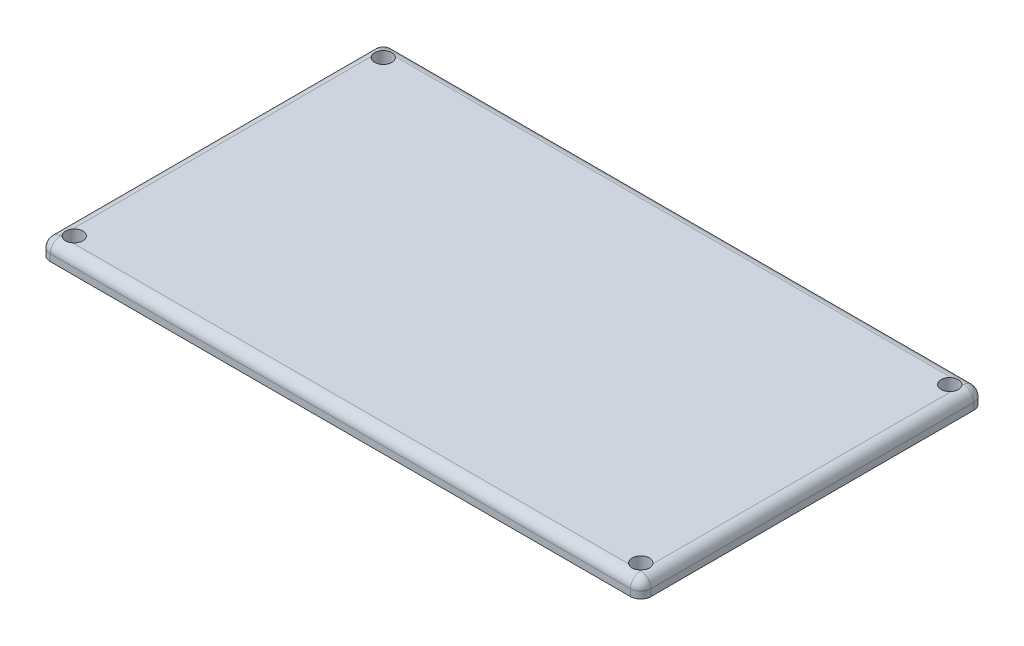
from build123d import *

# Parameters (mm, degrees)
SKETCH1_W           = 175
SKETCH1_H           = 100
BOSS_EXTRUDE1_DEPTH = 5
SKETCH2_R           = 2.5
CUT_EXTRUDE1_DEPTH  = 101.902180353
FILLET1_R           = 3


with BuildPart() as part:
    # Sketch1 → Boss-Extrude1 (new body)
    with BuildSketch(Plane(origin=(0, 0, 0), x_dir=(1, 0, 0), z_dir=(0, 1, 0))):
        Rectangle(SKETCH1_W, SKETCH1_H)
    extrude(amount=BOSS_EXTRUDE1_DEPTH)

    # Sketch2 → Cut-Extrude1 (cut, through all)
    with BuildSketch(Plane(origin=(0, 5, 0), x_dir=(1, 0, 0), z_dir=(0, 1, 0))):
        with Locations(Location((-82.5, 45, 0), (0, 0, 270))):
            Circle(SKETCH2_R)
        with Locations(Location((82.5, 45, 0), (0, 0, 90))):
            Circle(SKETCH2_R)
        with Locations(Location((82.5, -45, 0), (0, 0, 270))):
            Circle(SKETCH2_R)
        with Locations(Location((-82.5, -45, 0), (0, 0, 90))):
            Circle(SKETCH2_R)
    extrude(amount=-CUT_EXTRUDE1_DEPTH, mode=Mode.SUBTRACT)

    # Fillet1
    # the kernel refuses this fillet: 3 mm, written as the material it takes off along each edge
    with BuildSketch(Plane(origin=(-84.5, 2, 47), x_dir=(0, 1, 0), z_dir=(-1, 0, 0))) as fillet1_piece_1_section:
        Polygon((0, 0), (FILLET1_R, 0), (FILLET1_R, -FILLET1_R), (0, -FILLET1_R), align=None)
    fillet1_piece_1 = extrude(amount=FILLET1_R, mode=Mode.PRIVATE)
    fillet1_piece_1 = fillet1_piece_1 - Plane(origin=(-84.5, 2, 47), x_dir=(0, -0.7071067811865475, -0.7071067811865475), z_dir=(-1, 0, 0)) * Sphere(FILLET1_R, mode=Mode.PRIVATE)
    add(fillet1_piece_1, mode=Mode.SUBTRACT)
    with BuildSketch(Plane(origin=(-84.5, 2, -47), x_dir=(-1, 0, 0), z_dir=(0, 0, -1))) as fillet1_piece_2_section:
        Polygon((0, 0), (FILLET1_R, 0), (FILLET1_R, FILLET1_R), (0, FILLET1_R), align=None)
    fillet1_piece_2 = extrude(amount=FILLET1_R, mode=Mode.PRIVATE)
    fillet1_piece_2 = fillet1_piece_2 - Plane(origin=(-84.5, 2, -47), x_dir=(0.7071067811865475, -0.7071067811865475, 0), z_dir=(0, 0, -1)) * Sphere(FILLET1_R, mode=Mode.PRIVATE)
    add(fillet1_piece_2, mode=Mode.SUBTRACT)
    with BuildSketch(Plane(origin=(84.5, 2, 47), x_dir=(0, 1, 0), z_dir=(1, 0, 0))) as fillet1_piece_3_section:
        Polygon((0, 0), (FILLET1_R, 0), (FILLET1_R, FILLET1_R), (0, FILLET1_R), align=None)
    fillet1_piece_3 = extrude(amount=FILLET1_R, mode=Mode.PRIVATE)
    fillet1_piece_3 = fillet1_piece_3 - Plane(origin=(84.5, 2, 47), x_dir=(0, -0.7071067811865475, -0.7071067811865475), z_dir=(1, 0, 0)) * Sphere(FILLET1_R, mode=Mode.PRIVATE)
    add(fillet1_piece_3, mode=Mode.SUBTRACT)
    with BuildSketch(Plane(origin=(84.5, 2, -47), x_dir=(1, 0, 0), z_dir=(0, 0, -1))) as fillet1_piece_4_section:
        Polygon((0, 0), (FILLET1_R, 0), (FILLET1_R, -FILLET1_R), (0, -FILLET1_R), align=None)
    fillet1_piece_4 = extrude(amount=FILLET1_R, mode=Mode.PRIVATE)
    fillet1_piece_4 = fillet1_piece_4 - Plane(origin=(84.5, 2, -47), x_dir=(-0.7071067811865475, -0.7071067811865475, 0), z_dir=(0, 0, -1)) * Sphere(FILLET1_R, mode=Mode.PRIVATE)
    add(fillet1_piece_4, mode=Mode.SUBTRACT)
    with BuildSketch(Plane(origin=(-87.5, 5, 47), x_dir=(0, -1, 0), z_dir=(0, 0, -1)), Plane(origin=(87.5, 5, -47), x_dir=(0, -1, 0), z_dir=(0, 0, 1))) as fillet1_piece_5:
        with BuildLine():
            CenterArc((FILLET1_R, -FILLET1_R), FILLET1_R, 90, 90)
            Line((0, -FILLET1_R), (0, 0))
            Line((0, 0), (FILLET1_R, 0))
        make_face()
    extrude(amount=94, mode=Mode.SUBTRACT)
    with BuildSketch(Plane(origin=(84.5, 5, 50), x_dir=(0, 0, -1), z_dir=(-1, 0, 0))) as fillet1_piece_6:
        with BuildLine():
            CenterArc((FILLET1_R, FILLET1_R), FILLET1_R, 180, 90)
            Line((0, FILLET1_R), (0, 0))
            Line((0, 0), (FILLET1_R, 0))
        make_face()
    extrude(amount=169, mode=Mode.SUBTRACT)
    with BuildSketch(Plane(origin=(87.5, -7.5, 50), x_dir=(0, 0, -1), z_dir=(0, 1, 0)), Plane(origin=(87.5, -7.5, -50), x_dir=(-1, 0, 0), z_dir=(0, 1, 0))) as fillet1_piece_7:
        with BuildLine():
            CenterArc((FILLET1_R, FILLET1_R), FILLET1_R, 180, 90)
            Line((0, FILLET1_R), (0, 0))
            Line((0, 0), (FILLET1_R, 0))
        make_face()
    extrude(amount=9.5, mode=Mode.SUBTRACT)
    with BuildSketch(Plane(origin=(-87.5, -7.5, 50), x_dir=(0, 0, -1), z_dir=(0, 1, 0)), Plane(origin=(-87.5, -7.5, -50), x_dir=(1, 0, 0), z_dir=(0, 1, 0))) as fillet1_piece_8:
        with BuildLine():
            CenterArc((FILLET1_R, -FILLET1_R), FILLET1_R, 90, 90)
            Line((0, -FILLET1_R), (0, 0))
            Line((0, 0), (FILLET1_R, 0))
        make_face()
    extrude(amount=9.5, mode=Mode.SUBTRACT)
    with BuildSketch(Plane(origin=(-84.5, 5, -50), x_dir=(0, -1, 0), z_dir=(1, 0, 0))) as fillet1_piece_9:
        with BuildLine():
            CenterArc((FILLET1_R, -FILLET1_R), FILLET1_R, 90, 90)
            Line((0, -FILLET1_R), (0, 0))
            Line((0, 0), (FILLET1_R, 0))
        make_face()
    extrude(amount=169, mode=Mode.SUBTRACT)


solid = part.part
